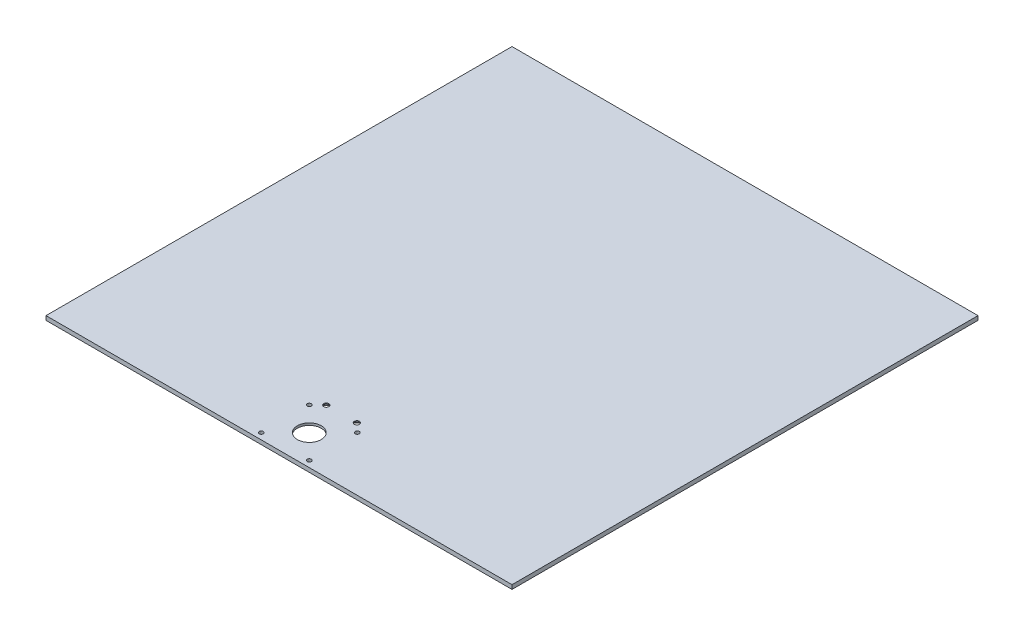
from build123d import *

# Parameters (mm, degrees)
SKETCH1_W                                           = 457.2
SKETCH1_H                                           = 457.2
BOSS_EXTRUDE1_DEPTH                                 = 4.064
SKETCH2_R                                           = 19.177
CUT_EXTRUDE1_DEPTH                                  = 1.905
CUT_EXTRUDE2_REACH                                  = 325.296
SKETCH3_R                                           = 11.7475
F_10_32_TAPPED_HOLE1_D                              = 4.0386
F_10_32_TAPPED_HOLE2_D                              = 4.0386
CBORE_FOR_10_BINDING_HEAD_MACHINE_SCREW_D           = 5.1054
CBORE_FOR_10_BINDING_HEAD_MACHINE_SCREW_CBORE_D     = 11.1125
CBORE_FOR_10_BINDING_HEAD_MACHINE_SCREW_CBORE_DEPTH = 3.1242


with BuildPart() as part:
    # Sketch1 → Boss-Extrude1 (new body)
    with BuildSketch(Plane(origin=(0, 0, 0), x_dir=(1, 0, 0), z_dir=(0, 1, 0))):
        Rectangle(SKETCH1_W, SKETCH1_H)
    extrude(amount=BOSS_EXTRUDE1_DEPTH)

    # Sketch2 → Cut-Extrude1 (cut)
    with BuildSketch(Plane.XZ):
        with Locations((0, 198.882)):
            Circle(SKETCH2_R)
    extrude(amount=-CUT_EXTRUDE1_DEPTH, mode=Mode.SUBTRACT)

    # Sketch3 → Cut-Extrude2 (cut, up to next)
    with BuildSketch(Plane.XZ.offset(-1.905), mode=Mode.PRIVATE) as cut_extrude2_sk1:
        with Locations((0, 198.882)):
            Circle(SKETCH3_R)
    cut_extrude2_tool1 = extrude(cut_extrude2_sk1.sketch, amount=-CUT_EXTRUDE2_REACH, mode=Mode.PRIVATE) & part.part
    add(cut_extrude2_tool1.solids().sort_by_distance((0, 1.905, 198.882))[0], mode=Mode.SUBTRACT)

    # #10-32 Tapped Hole1 (through all)
    with Locations(Plane(origin=(0, 0, 0), x_dir=(-0.9999999805352008, 0, 0.00019730584980051711), z_dir=(0, -1, 0))):
        with Locations((23.617063566, -222.450516863), (-23.529280152, -222.459819113)):
            Hole(F_10_32_TAPPED_HOLE1_D / 2)

    # #10-32 Tapped Hole2 (through all)
    with Locations(Plane(origin=(0, 0, 0), x_dir=(-0.9999999805352008, 0, 0.00019730584980051711), z_dir=(0, -1, 0))):
        with Locations((23.607761316, -175.304173145), (-23.538582402, -175.313475395)):
            Hole(F_10_32_TAPPED_HOLE2_D / 2)

    # CBORE for #10 Binding Head Machine Screw1 (through all)
    with Locations(Plane.XZ):
        with Locations((-15, 167.174500066), (15, 167.174500066)):
            CounterBoreHole(CBORE_FOR_10_BINDING_HEAD_MACHINE_SCREW_D / 2, CBORE_FOR_10_BINDING_HEAD_MACHINE_SCREW_CBORE_D / 2, CBORE_FOR_10_BINDING_HEAD_MACHINE_SCREW_CBORE_DEPTH)


solid = part.part
